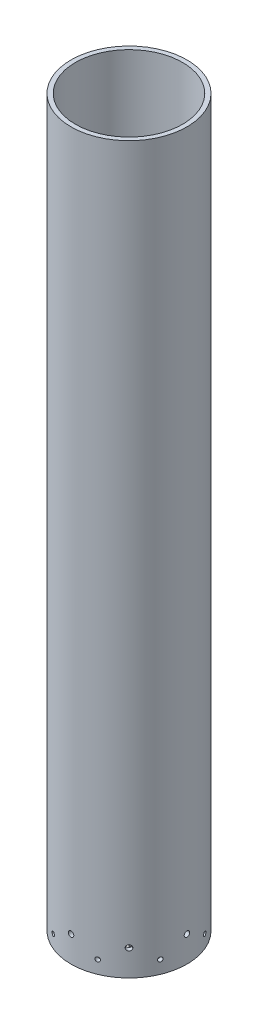
from build123d import *

# Parameters (mm, degrees)
SKETCH1_R                = 40
SKETCH1_R_2              = 36.95
BOSS_EXTRUDE1_DEPTH      = 500
SKETCH2_R                = 1.9
CUT_EXTRUDE1_DEPTH       = 66
BOSS_EXTRUDE2_DEPTH      = 10
BOSS_EXTRUDE2_DEPTH_BACK = 18
SKETCH4_R                = 1.5
CUT_EXTRUDE2_DEPTH       = 68
CIRPATTERN1_COUNT        = 8
SKETCH7_R                = 1
BOSS_EXTRUDE3_DEPTH      = 10


with BuildPart() as part:
    # Sketch1 → Boss-Extrude1 (new body)
    with BuildSketch(Plane(origin=(0, 0, 0), x_dir=(1, 0, 0), z_dir=(0, 1, 0))):
        Circle(SKETCH1_R)
        Circle(SKETCH1_R_2, mode=Mode.SUBTRACT)
    extrude(amount=BOSS_EXTRUDE1_DEPTH)

    # Sketch2 → Cut-Extrude1 (cut)
    with BuildSketch(Plane.XY):
        with Locations((0, 18)):
            Circle(SKETCH2_R)
    cut_extrude1 = extrude(amount=-CUT_EXTRUDE1_DEPTH, mode=Mode.SUBTRACT)

    # Sketch4 → Cut-Extrude2 (cut)
    with BuildSketch(Plane(origin=(0, 0, 0), x_dir=(0.38268343236509056, 0, 0.9238795325112865), z_dir=(-0.9238795325112865, 0, 0.38268343236509056))):
        with Locations((0, 9)):
            Circle(SKETCH4_R)
    cut_extrude2 = extrude(amount=-CUT_EXTRUDE2_DEPTH, mode=Mode.SUBTRACT)

    # CirPattern1: Cut-Extrude1, Cut-Extrude2 ×8 about axis
    cirpattern1_axis = Axis((0, 500, 0), (0, -1, 0))
    add([cut_extrude1.rotate(cirpattern1_axis, i * 360 / CIRPATTERN1_COUNT) for i in range(1, CIRPATTERN1_COUNT)], mode=Mode.SUBTRACT)
    add([cut_extrude2.rotate(cirpattern1_axis, i * 360 / CIRPATTERN1_COUNT) for i in range(1, CIRPATTERN1_COUNT)], mode=Mode.SUBTRACT)


with BuildPart() as body_2:
    # Sketch3 → Boss-Extrude2 (new, two sides: drawn at the far end of the back side and taken through both)
    with BuildSketch(Plane.XZ.offset(-BOSS_EXTRUDE2_DEPTH_BACK)):
        Polygon((0, 0), (0, -21.702900421), (-8.438709289, -20.372846414), align=None)
    extrude(amount=BOSS_EXTRUDE2_DEPTH + BOSS_EXTRUDE2_DEPTH_BACK)

    # Sketch7 → Boss-Extrude3 (add)
    with BuildSketch(Plane(origin=(0, 18, 0), x_dir=(1, 0, 0), z_dir=(0, 1, 0))):
        with Locations((-3.319315298, 15.236201366)):
            Circle(SKETCH7_R)
    extrude(amount=BOSS_EXTRUDE3_DEPTH)


solid = Compound([part.part, body_2.part])
